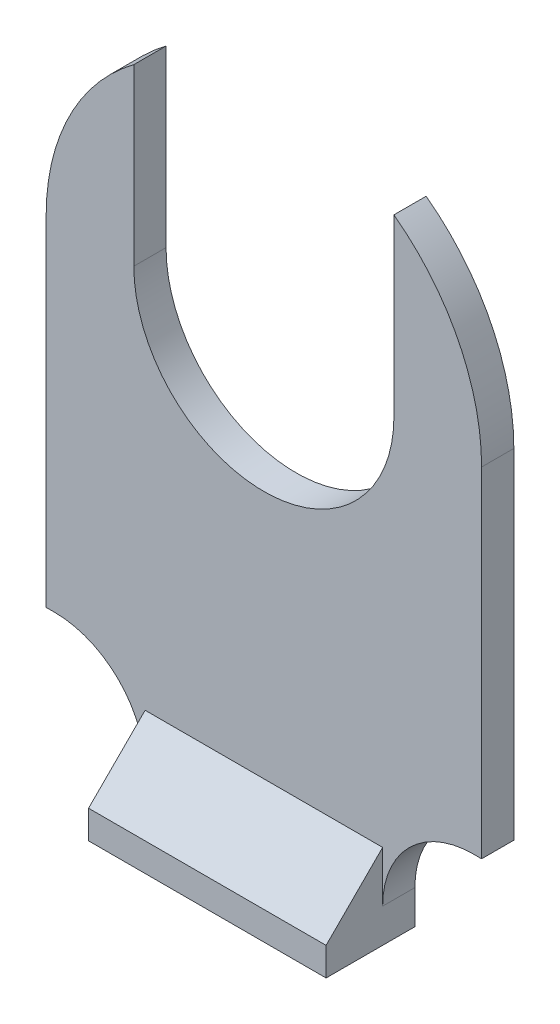
from build123d import *

# Parameters (mm, degrees)
EXTRUDE_1_DEPTH     = 1.24
CUT_EXTRUDE_1_DEPTH = 1.24
SKETCH_4_W          = 8.4
SKETCH_4_H          = 3
EXTRUDE_2_DEPTH     = 2.2
CHAMFER_1_SIZE      = 1.2
CHAMFER_1_SIZE_2    = 2.4
SKETCH_5_W          = 8.4
SKETCH_5_H          = 4.2
CUT_EXTRUDE_2_DEPTH = 23.25946091
SKETCH_6_W          = 8.4
SKETCH_6_H          = 3
EXTRUDE_3_DEPTH     = 2
CHAMFER_2_SIZE      = 2
CUT_EXTRUDE_3_DEPTH = 0.1


# Some blends are built 0.0001 mm under size
with BuildPart() as part:
    # Эскиз1 → Бобышка-Вытянуть1 (new body)
    with BuildSketch(Plane.XY):
        with BuildLine():
            Line((-4.6, 0), (-4.6, 6.174949393))
            ThreePointArc((-4.6, 6.174949393), (-6.88149693, 3.454706934), (-7.7, 0))
            Line((-7.7, 0), (-7.7, -20.6))
            Line((-7.7, -20.6), (7.7, -20.6))
            Line((7.7, -20.6), (7.7, 0))
            ThreePointArc((7.7, 0), (6.88149693, 3.454706934), (4.6, 6.174949393))
            Line((4.6, 6.174949393), (4.6, 0))
            ThreePointArc((4.6, 0), (0, -4.6), (-4.6, 0))
        make_face()
    extrude(amount=EXTRUDE_1_DEPTH)

    # Эскиз3 → Вырез-Вытянуть1 (cut)
    with BuildSketch(Plane.XY.offset(1.24)):
        with BuildLine():
            Line((-7.7, -20.6), (-4.2, -20.6))
            Line((-4.2, -20.6), (-4.2, -15.2))
            ThreePointArc((-4.2, -15.2), (-5.1372583, -12.9372583), (-7.4, -12))
            Line((-7.4, -12), (-7.7, -12))
            Line((-7.7, -12), (-7.7, -20.6))
        make_face()
        with BuildLine():
            Line((4.2, -20.6), (4.2, -15.2))
            ThreePointArc((4.2, -15.2), (5.1372583, -12.9372583), (7.4, -12))
            Line((7.4, -12), (7.7, -12))
            Line((7.7, -12), (7.7, -20.6))
            Line((7.7, -20.6), (4.2, -20.6))
        make_face()
    extrude(amount=-CUT_EXTRUDE_1_DEPTH, mode=Mode.SUBTRACT)

    # Эскиз4 → Бобышка-Вытянуть2 (add)
    with BuildSketch(Plane.XY.offset(1.24)):
        with Locations((0, -19.1)):
            Rectangle(SKETCH_4_W, SKETCH_4_H)
    extrude(amount=EXTRUDE_2_DEPTH)

    # Фаска1
    # the kernel refuses this chamfer: 2.4, 1.2 mm, written as the material it adds along each edge
    with BuildSketch(Plane(origin=(4.2, -17.6, 1.24), x_dir=(0, 0.9976223042390325, -0.06891834360170876), z_dir=(-1, 0, 0))) as chamfer_1_piece_1_section:
        Polygon((CHAMFER_1_SIZE * 0.997622304239, -CHAMFER_1_SIZE * 0.0689183436017), (-CHAMFER_1_SIZE_2 * 0.0689183436017, -CHAMFER_1_SIZE_2 * 0.997622304239), (0, 0), align=None)
    chamfer_1_piece_1 = extrude(amount=8.4, mode=Mode.PRIVATE)
    chamfer_1_piece_1 = split(chamfer_1_piece_1, bisect_by=Plane(origin=(0, -17.211387721, 3.44), z_dir=(0, 0, -1)), keep=Keep.TOP, mode=Mode.PRIVATE)
    add(chamfer_1_piece_1)

    # Эскиз5 → Вырез-Вытянуть2 (cut, through all)
    with BuildSketch(Plane.XY.offset(3.44)):
        with Locations((0, -18.5)):
            Rectangle(SKETCH_5_W, SKETCH_5_H)
    extrude(amount=-CUT_EXTRUDE_2_DEPTH, mode=Mode.SUBTRACT)

    # Эскиз6 → Бобышка-Вытянуть3 (add)
    with BuildSketch(Plane.XY.offset(1.24)):
        with Locations((0, -14.9)):
            Rectangle(SKETCH_6_W, SKETCH_6_H)
    extrude(amount=EXTRUDE_3_DEPTH)

    # Фаска2
    chamfer_2_edges = [part.edges().sort_by_distance(p)[0] for p in [
        (0, -13.4, 3.24),
    ]]
    chamfer(chamfer_2_edges, length=CHAMFER_2_SIZE - 0.0001)  # a hair under: the kernel refuses the full size

    # Эскиз7 → Вырез-Вытянуть3 (cut)
    with BuildSketch(Plane(origin=(0, 0, 0), x_dir=(-1, 0, 0), z_dir=(0, 0, -1))):
        with BuildLine():
            Line((-4.2, -15.2), (-4.2, -16.4))
            Line((-4.2, -16.4), (4.2, -16.4))
            Line((4.2, -16.4), (4.2, -15.2))
            ThreePointArc((4.2, -15.2), (5.1372583, -12.9372583), (7.4, -12))
            Line((7.4, -12), (7.7, -12))
            Line((7.7, -12), (7.7, 0))
            ThreePointArc((7.7, 0), (6.88149693, 3.454706934), (4.6, 6.174949393))
            Line((4.6, 6.174949393), (4.6, 0))
            ThreePointArc((4.6, 0), (0, -4.6), (-4.6, 0))
            Line((-4.6, 0), (-4.6, 6.174949393))
            ThreePointArc((-4.6, 6.174949393), (-6.88149693, 3.454706934), (-7.7, 0))
            Line((-7.7, 0), (-7.7, -12))
            Line((-7.7, -12), (-7.4, -12))
            ThreePointArc((-7.4, -12), (-5.1372583, -12.9372583), (-4.2, -15.2))
        make_face()
    extrude(amount=-CUT_EXTRUDE_3_DEPTH, mode=Mode.SUBTRACT)


solid = part.part
